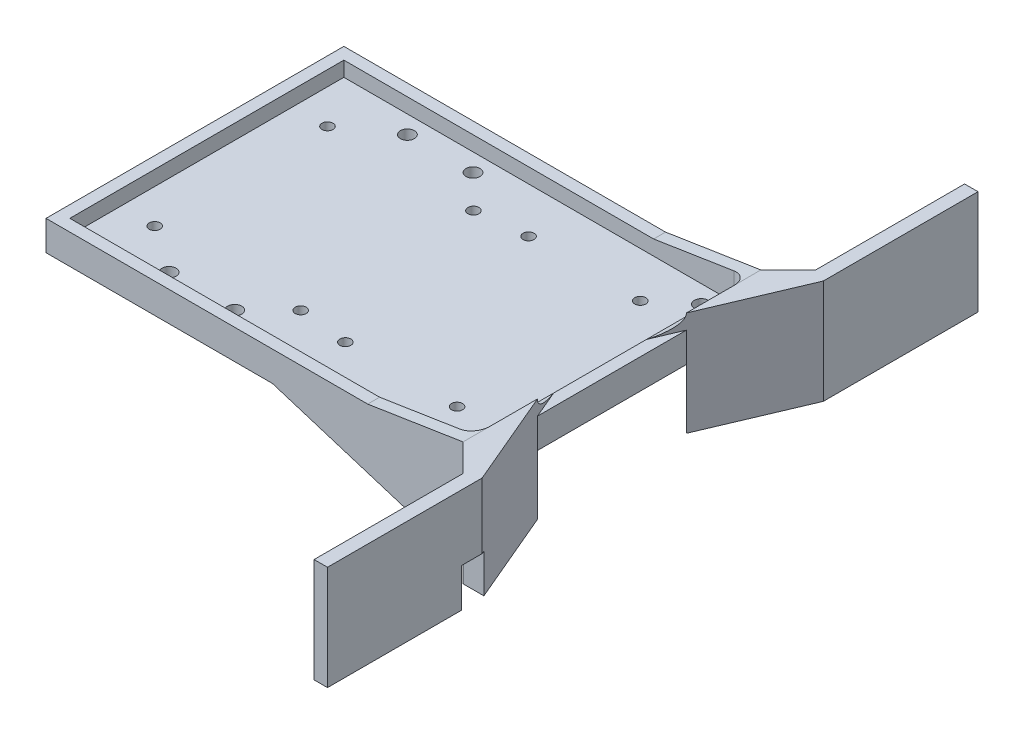
from build123d import *

# Parameters (mm, degrees)
SKETCH1_W                = 140
SKETCH1_H                = 100
BOSS_EXTRUDE1_DEPTH      = 10
SKETCH2_W                = 132
SKETCH2_H                = 92
CUT_EXTRUDE1_DEPTH       = 5
CUT_EXTRUDE2_REACH       = 88.168
SKETCH6_R                = 2.35
CUT_EXTRUDE3_REACH       = 88.168
SKETCH9_R                = 1.85
BOSS_EXTRUDE2_DEPTH      = 15
BOSS_EXTRUDE2_DEPTH_BACK = 20
BOSS_EXTRUDE3_DEPTH      = 4
FILLET3_R                = 5
FILLET4_R                = 5
FILLET5_R                = 5
FILLET6_R                = 5
FILLET7_R                = 14
CUT_EXTRUDE4_REACH       = 191.59
SKETCH13_W               = 8
SKETCH13_H               = 13


with BuildPart() as part:
    # Sketch1 → Boss-Extrude1 (new body)
    with BuildSketch(Plane(origin=(0, 0, 0), x_dir=(1, 0, 0), z_dir=(0, 1, 0))):
        Rectangle(SKETCH1_W, SKETCH1_H)
    extrude(amount=BOSS_EXTRUDE1_DEPTH)

    # Sketch2 → Cut-Extrude1 (cut)
    with BuildSketch(Plane(origin=(0, 10, 0), x_dir=(1, 0, 0), z_dir=(0, 1, 0))):
        Rectangle(SKETCH2_W, SKETCH2_H)
    extrude(amount=-CUT_EXTRUDE1_DEPTH, mode=Mode.SUBTRACT)

    # Sketch6 → Cut-Extrude2 (cut, up to next)
    with BuildSketch(Plane(origin=(0, 5, 0), x_dir=(1, 0, 0), z_dir=(0, 1, 0)), mode=Mode.PRIVATE) as cut_extrude2_sk1:
        with Locations(Location((60, 40, 0), (0, 0, 270))):
            Circle(SKETCH6_R)
    cut_extrude2_tool1 = extrude(cut_extrude2_sk1.sketch, amount=-CUT_EXTRUDE2_REACH, mode=Mode.PRIVATE) & part.part
    # Sketch6 → Cut-Extrude2 (cut, up to next)
    with BuildSketch(Plane(origin=(0, 5, 0), x_dir=(1, 0, 0), z_dir=(0, 1, 0)), mode=Mode.PRIVATE) as cut_extrude2_sk2:
        with Locations(Location((60, -40, 0), (0, 0, 270))):
            Circle(SKETCH6_R)
    cut_extrude2_tool2 = extrude(cut_extrude2_sk2.sketch, amount=-CUT_EXTRUDE2_REACH, mode=Mode.PRIVATE) & part.part
    # Sketch6 → Cut-Extrude2 (cut, up to next)
    with BuildSketch(Plane(origin=(0, 5, 0), x_dir=(1, 0, 0), z_dir=(0, 1, 0)), mode=Mode.PRIVATE) as cut_extrude2_sk3:
        with Locations(Location((-16.641543992, -40, 0), (0, 0, 270))):
            Circle(SKETCH6_R)
    cut_extrude2_tool3 = extrude(cut_extrude2_sk3.sketch, amount=-CUT_EXTRUDE2_REACH, mode=Mode.PRIVATE) & part.part
    # Sketch6 → Cut-Extrude2 (cut, up to next)
    with BuildSketch(Plane(origin=(0, 5, 0), x_dir=(1, 0, 0), z_dir=(0, 1, 0)), mode=Mode.PRIVATE) as cut_extrude2_sk4:
        with Locations(Location((-16.641543992, 40, 0), (0, 0, 270))):
            Circle(SKETCH6_R)
    cut_extrude2_tool4 = extrude(cut_extrude2_sk4.sketch, amount=-CUT_EXTRUDE2_REACH, mode=Mode.PRIVATE) & part.part
    # Sketch6 → Cut-Extrude2 (cut, up to next)
    with BuildSketch(Plane(origin=(0, 5, 0), x_dir=(1, 0, 0), z_dir=(0, 1, 0)), mode=Mode.PRIVATE) as cut_extrude2_sk5:
        with Locations(Location((-38.674837349, -40, 0), (0, 0, 270))):
            Circle(SKETCH6_R)
    cut_extrude2_tool5 = extrude(cut_extrude2_sk5.sketch, amount=-CUT_EXTRUDE2_REACH, mode=Mode.PRIVATE) & part.part
    # Sketch6 → Cut-Extrude2 (cut, up to next)
    with BuildSketch(Plane(origin=(0, 5, 0), x_dir=(1, 0, 0), z_dir=(0, 1, 0)), mode=Mode.PRIVATE) as cut_extrude2_sk6:
        with Locations(Location((-38.674837349, 40, 0), (0, 0, 270))):
            Circle(SKETCH6_R)
    cut_extrude2_tool6 = extrude(cut_extrude2_sk6.sketch, amount=-CUT_EXTRUDE2_REACH, mode=Mode.PRIVATE) & part.part
    add(cut_extrude2_tool1.solids().sort_by_distance((60, 5, -40))[0], mode=Mode.SUBTRACT)
    add(cut_extrude2_tool2.solids().sort_by_distance((60, 5, 40))[0], mode=Mode.SUBTRACT)
    add(cut_extrude2_tool3.solids().sort_by_distance((-16.641544, 5, 40))[0], mode=Mode.SUBTRACT)
    add(cut_extrude2_tool4.solids().sort_by_distance((-16.641544, 5, -40))[0], mode=Mode.SUBTRACT)
    add(cut_extrude2_tool5.solids().sort_by_distance((-38.674837, 5, 40))[0], mode=Mode.SUBTRACT)
    add(cut_extrude2_tool6.solids().sort_by_distance((-38.674837, 5, -40))[0], mode=Mode.SUBTRACT)

    # Sketch9 → Cut-Extrude3 (cut, up to next)
    with BuildSketch(Plane(origin=(0, 5, 0), x_dir=(1, 0, 0), z_dir=(0, 1, 0)), mode=Mode.PRIVATE) as cut_extrude3_sk1:
        with Locations(Location((-54.5, 29, 0), (0, 0, 270))):
            Circle(SKETCH9_R)
    cut_extrude3_tool1 = extrude(cut_extrude3_sk1.sketch, amount=-CUT_EXTRUDE3_REACH, mode=Mode.PRIVATE) & part.part
    # Sketch9 → Cut-Extrude3 (cut, up to next)
    with BuildSketch(Plane(origin=(0, 5, 0), x_dir=(1, 0, 0), z_dir=(0, 1, 0)), mode=Mode.PRIVATE) as cut_extrude3_sk2:
        with Locations(Location((-5.5, 29, 0), (0, 0, 270))):
            Circle(SKETCH9_R)
    cut_extrude3_tool2 = extrude(cut_extrude3_sk2.sketch, amount=-CUT_EXTRUDE3_REACH, mode=Mode.PRIVATE) & part.part
    # Sketch9 → Cut-Extrude3 (cut, up to next)
    with BuildSketch(Plane(origin=(0, 5, 0), x_dir=(1, 0, 0), z_dir=(0, 1, 0)), mode=Mode.PRIVATE) as cut_extrude3_sk3:
        with Locations(Location((-54.5, -29, 0), (0, 0, 270))):
            Circle(SKETCH9_R)
    cut_extrude3_tool3 = extrude(cut_extrude3_sk3.sketch, amount=-CUT_EXTRUDE3_REACH, mode=Mode.PRIVATE) & part.part
    # Sketch9 → Cut-Extrude3 (cut, up to next)
    with BuildSketch(Plane(origin=(0, 5, 0), x_dir=(1, 0, 0), z_dir=(0, 1, 0)), mode=Mode.PRIVATE) as cut_extrude3_sk4:
        with Locations(Location((-5.5, -29, 0), (0, 0, 270))):
            Circle(SKETCH9_R)
    cut_extrude3_tool4 = extrude(cut_extrude3_sk4.sketch, amount=-CUT_EXTRUDE3_REACH, mode=Mode.PRIVATE) & part.part
    # Sketch9 → Cut-Extrude3 (cut, up to next)
    with BuildSketch(Plane(origin=(0, 5, 0), x_dir=(1, 0, 0), z_dir=(0, 1, 0)), mode=Mode.PRIVATE) as cut_extrude3_sk5:
        with Locations(Location((11.25, 30.75, 0), (0, 0, 270))):
            Circle(SKETCH9_R)
    cut_extrude3_tool5 = extrude(cut_extrude3_sk5.sketch, amount=-CUT_EXTRUDE3_REACH, mode=Mode.PRIVATE) & part.part
    # Sketch9 → Cut-Extrude3 (cut, up to next)
    with BuildSketch(Plane(origin=(0, 5, 0), x_dir=(1, 0, 0), z_dir=(0, 1, 0)), mode=Mode.PRIVATE) as cut_extrude3_sk6:
        with Locations(Location((48.75, 30.75, 0), (0, 0, 270))):
            Circle(SKETCH9_R)
    cut_extrude3_tool6 = extrude(cut_extrude3_sk6.sketch, amount=-CUT_EXTRUDE3_REACH, mode=Mode.PRIVATE) & part.part
    # Sketch9 → Cut-Extrude3 (cut, up to next)
    with BuildSketch(Plane(origin=(0, 5, 0), x_dir=(1, 0, 0), z_dir=(0, 1, 0)), mode=Mode.PRIVATE) as cut_extrude3_sk7:
        with Locations(Location((48.75, -30.75, 0), (0, 0, 270))):
            Circle(SKETCH9_R)
    cut_extrude3_tool7 = extrude(cut_extrude3_sk7.sketch, amount=-CUT_EXTRUDE3_REACH, mode=Mode.PRIVATE) & part.part
    # Sketch9 → Cut-Extrude3 (cut, up to next)
    with BuildSketch(Plane(origin=(0, 5, 0), x_dir=(1, 0, 0), z_dir=(0, 1, 0)), mode=Mode.PRIVATE) as cut_extrude3_sk8:
        with Locations(Location((11.25, -30.75, 0), (0, 0, 270))):
            Circle(SKETCH9_R)
    cut_extrude3_tool8 = extrude(cut_extrude3_sk8.sketch, amount=-CUT_EXTRUDE3_REACH, mode=Mode.PRIVATE) & part.part
    add(cut_extrude3_tool1.solids().sort_by_distance((-54.5, 5, -29))[0], mode=Mode.SUBTRACT)
    add(cut_extrude3_tool2.solids().sort_by_distance((-5.5, 5, -29))[0], mode=Mode.SUBTRACT)
    add(cut_extrude3_tool3.solids().sort_by_distance((-54.5, 5, 29))[0], mode=Mode.SUBTRACT)
    add(cut_extrude3_tool4.solids().sort_by_distance((-5.5, 5, 29))[0], mode=Mode.SUBTRACT)
    add(cut_extrude3_tool5.solids().sort_by_distance((11.25, 5, -30.75))[0], mode=Mode.SUBTRACT)
    add(cut_extrude3_tool6.solids().sort_by_distance((48.75, 5, -30.75))[0], mode=Mode.SUBTRACT)
    add(cut_extrude3_tool7.solids().sort_by_distance((48.75, 5, 30.75))[0], mode=Mode.SUBTRACT)
    add(cut_extrude3_tool8.solids().sort_by_distance((11.25, 5, 30.75))[0], mode=Mode.SUBTRACT)

    # Sketch11 → Boss-Extrude2 (add, two sides: drawn at the far end of the back side and taken through both)
    with BuildSketch(Plane(origin=(0, 0, 0), x_dir=(1, 0, 0), z_dir=(0, 1, 0)).offset(-BOSS_EXTRUDE2_DEPTH_BACK)):
        Polygon((70, 50), (79.192388155, 59.192388155), (79.192388155, 109.192388155), (83.692388155, 109.192388155), (83.692388155, 57.25724503), (70, 25), align=None)
        Polygon((70, -25), (70, -50), (79.192388155, -59.192388155), (79.192388155, -109.192388155), (83.692388155, -109.192388155), (83.692388155, -57.25724503), align=None)
    extrude(amount=BOSS_EXTRUDE2_DEPTH + BOSS_EXTRUDE2_DEPTH_BACK)

    # Sketch12 → Boss-Extrude3 (add)
    with BuildSketch(Plane(origin=(0, 0, -50), x_dir=(-1, 0, 0), z_dir=(0, 0, -1))):
        Polygon((-70, 15), (-38, 10), (-70, 10), align=None)
        Polygon((-70, -20), (-70, 0), (-6, 0), align=None)
    boss_extrude3 = extrude(amount=-BOSS_EXTRUDE3_DEPTH)

    # Fillet3
    # the kernel refuses this fillet: 5 mm, written as the material it adds along each edge
    with BuildSketch(Plane(origin=(70, 10, -58.247448714), x_dir=(0, 1, 0), z_dir=(0, 0, 1))) as fillet3_piece_1_section:
        with BuildLine():
            CenterArc((4.898979486, 5), FILLET3_R, 191.536959033, 78.463040967)
            Line((0, 4), (0, 0))
            Line((0, 0), (4.898979486, 0))
        make_face()
    fillet3_piece_1 = extrude(amount=45.494897428, mode=Mode.PRIVATE)
    fillet3_piece_1 = split(fillet3_piece_1, bisect_by=Plane(origin=(81.95810656, 10, -53.17153363), z_dir=(-0.9205048534524429, 0, -0.3907311284892677)), keep=Keep.TOP, mode=Mode.PRIVATE)
    fillet3_piece_1 = split(fillet3_piece_1, bisect_by=Plane(origin=(74.123724357, 10, -54.123724357), z_dir=(0.7071067811865478, 0, 0.7071067811865472)), keep=Keep.TOP, mode=Mode.PRIVATE)
    add(fillet3_piece_1)

    # Fillet4
    # the kernel refuses this fillet: 5 mm, written as the material it adds along each edge
    with BuildSketch(Plane(origin=(70, 2.398979486, -46), x_dir=(0, 0, 1), z_dir=(0, 1, 0))) as fillet4_piece_1_section:
        with BuildLine():
            CenterArc((FILLET4_R, -FILLET4_R), FILLET4_R, 90, 90)
            Line((0, -FILLET4_R), (0, 0))
            Line((0, 0), (FILLET4_R, 0))
        make_face()
    fillet4_piece_1 = extrude(amount=25.101020514, mode=Mode.PRIVATE)
    fillet4_piece_1 = split(fillet4_piece_1, bisect_by=Plane(origin=(68.07801403, 14.699689692, -46), z_dir=(0.15437688027360966, -0.9880120337511015, 0)), keep=Keep.TOP, mode=Mode.PRIVATE)
    add(fillet4_piece_1)

    # Mirror6: Boss-Extrude3 across plane
    add(boss_extrude3.mirror(Plane.XY))

    # Fillet5
    # the kernel refuses this fillet: 5 mm, written as the material it adds along each edge
    with BuildSketch(Plane(origin=(70, 10, 12.752551286), x_dir=(-1.0, 1.5649703755111202e-12, 0), z_dir=(0, 0, 1))) as fillet5_piece_1_section:
        with BuildLine():
            CenterArc((5, -4.898979486), FILLET5_R, 101.536959033, 78.463040967)
            Line((0, -4.898979486), (0, 0))
            Line((0, 0), (4, 0))
        make_face()
    fillet5_piece_1 = extrude(amount=45.494897428, mode=Mode.PRIVATE)
    fillet5_piece_1 = split(fillet5_piece_1, bisect_by=Plane(origin=(51.376275643, 10, 31.376275643), z_dir=(0.7071067811865478, 0, -0.7071067811865472)), keep=Keep.TOP, mode=Mode.PRIVATE)
    fillet5_piece_1 = split(fillet5_piece_1, bisect_by=Plane(origin=(65.594961344, 10, 14.62237926), z_dir=(-0.9205048534524429, 0, 0.3907311284892677)), keep=Keep.TOP, mode=Mode.PRIVATE)
    add(fillet5_piece_1)

    # Fillet6
    # the kernel refuses this fillet: 5 mm, written as the material it adds along each edge
    with BuildSketch(Plane(origin=(70, 2.398979486, 46), x_dir=(-1, 0, 0), z_dir=(0, 1, 0))) as fillet6_piece_1_section:
        with BuildLine():
            CenterArc((FILLET6_R, -FILLET6_R), FILLET6_R, 90, 90)
            Line((0, -FILLET6_R), (0, 0))
            Line((0, 0), (FILLET6_R, 0))
        make_face()
    fillet6_piece_1 = extrude(amount=25.101020514, mode=Mode.PRIVATE)
    fillet6_piece_1 = split(fillet6_piece_1, bisect_by=Plane(origin=(68.07801403, 14.699689692, 46), z_dir=(0.15437688027360966, -0.9880120337511015, 0)), keep=Keep.TOP, mode=Mode.PRIVATE)
    add(fillet6_piece_1)

    # Fillet7
    fillet7_edges = [part.edges().sort_by_distance(p)[0] for p in [
        (70, -10, -46),
        (70, -10, 46),
    ]]
    fillet(fillet7_edges, radius=FILLET7_R)

    # Sketch13 → Cut-Extrude4 (cut, up to next)
    with BuildSketch(Plane(origin=(83.692388155, 0, 0), x_dir=(0, 0, -1), z_dir=(1, 0, 0)), mode=Mode.PRIVATE) as cut_extrude4_sk1:
        with Locations((-60.25724503, -13.5)):
            Rectangle(SKETCH13_W, SKETCH13_H)
    cut_extrude4_tool1 = extrude(cut_extrude4_sk1.sketch, amount=-CUT_EXTRUDE4_REACH, mode=Mode.PRIVATE) & part.part
    add(cut_extrude4_tool1.solids().sort_by_distance((83.692388, -13.5, 60.257245))[0], mode=Mode.SUBTRACT)


solid = part.part
